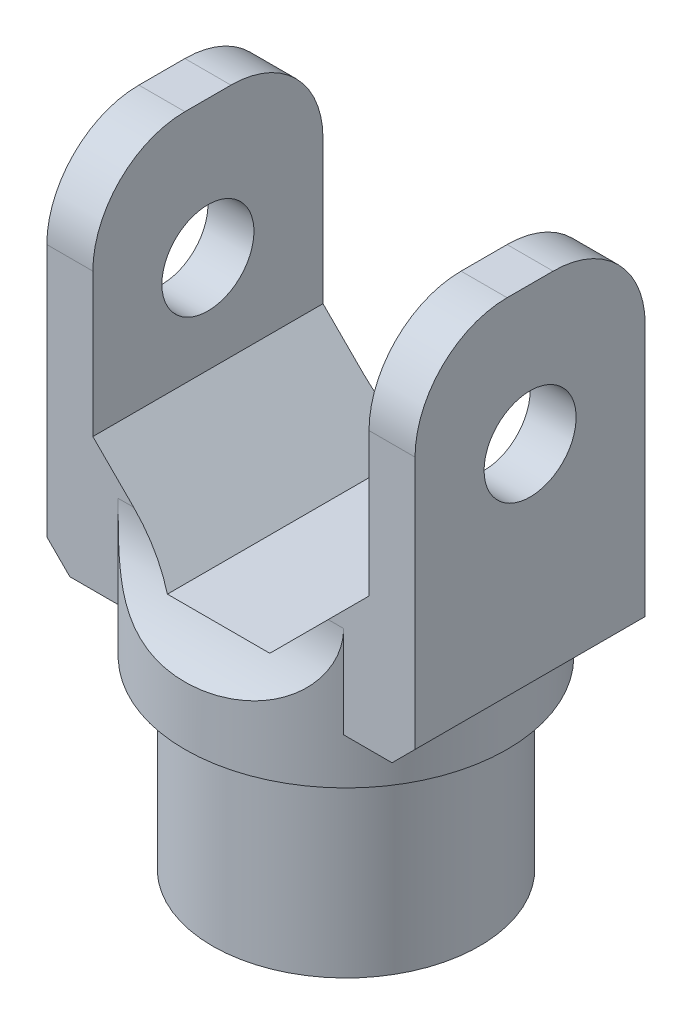
from build123d import *

# Parameters (mm, degrees)
SKETCH2_R           = 18.415
SKETCH2_R_2         = 15.875
BOSS_EXTRUDE1_DEPTH = 25.4
SKETCH3_R           = 22.225
BOSS_EXTRUDE2_DEPTH = 6.35
SKETCH5_W           = 50.8
SKETCH5_H           = 31.75
BOSS_EXTRUDE3_DEPTH = 50.8
CUT_EXTRUDE2_DEPTH  = 50.8
FILLET1_R           = 12.7
SKETCH9_R           = 6.35
CUT_EXTRUDE3_DEPTH  = 100.443919497
FILLET2_R           = 12.7


with BuildPart() as part:
    # Sketch2 → Boss-Extrude1 (new body)
    with BuildSketch(Plane(origin=(0, 0, 0), x_dir=(1, 0, 0), z_dir=(0, 1, 0))):
        with Locations(Location((0, 0, 0), (0, 0, 270))):
            Circle(SKETCH2_R)
        with Locations(Location((0, 0, 0), (0, 0, 270))):
            Circle(SKETCH2_R_2, mode=Mode.SUBTRACT)
    extrude(amount=BOSS_EXTRUDE1_DEPTH)

    # Sketch3 → Boss-Extrude2 (add)
    with BuildSketch(Plane(origin=(0, 25.4, 0), x_dir=(1, 0, 0), z_dir=(0, 1, 0))):
        with Locations(Location((0, 0, 0), (0, 0, 270))):
            Circle(SKETCH3_R)
    extrude(amount=BOSS_EXTRUDE2_DEPTH)

    # Sketch5 → Boss-Extrude3 (add)
    with BuildSketch(Plane(origin=(0, 31.75, 0), x_dir=(1, 0, 0), z_dir=(0, 1, 0))):
        Rectangle(SKETCH5_W, SKETCH5_H)
    extrude(amount=BOSS_EXTRUDE3_DEPTH)

    # Sketch7 → Cut-Extrude2 (cut)
    with BuildSketch(Plane.XY.offset(15.875)):
        Polygon((19.05, 82.55), (-19.05, 82.55), (-19.05, 50.084319149), (-7.065680851, 38.1), (7.065680851, 38.1), (19.05, 50.084319149), align=None)
        Polygon((-22.225, 31.75), (-25.4, 34.925), (-25.4, 31.75), align=None)
        Polygon((22.225, 31.75), (25.4, 34.925), (25.4, 31.75), align=None)
    extrude(amount=-CUT_EXTRUDE2_DEPTH, mode=Mode.SUBTRACT)

    # Fillet1
    fillet1_edges = [part.edges().sort_by_distance(p)[0] for p in [
        (22.225, 82.55, -15.875),
        (-22.225, 82.55, 15.875),
        (-22.225, 82.55, -15.875),
        (22.225, 82.55, 15.875),
    ]]
    fillet(fillet1_edges, radius=FILLET1_R)

    # Sketch9 → Cut-Extrude3 (cut, through all)
    with BuildSketch(Plane.ZY.offset(25.4)):
        with Locations((0, 63.5)):
            Circle(SKETCH9_R)
    extrude(amount=-CUT_EXTRUDE3_DEPTH, mode=Mode.SUBTRACT)

    # Fillet2
    # the kernel refuses this fillet: 12.7 mm, written as the material it adds along each edge
    with BuildSketch(Plane(origin=(-47.304259867, 31.75, 15.875), x_dir=(0, 1, 0), z_dir=(1, 0, 0))) as fillet2_piece_1_section:
        with BuildLine():
            CenterArc((FILLET2_R, FILLET2_R), FILLET2_R, 180, 90)
            Line((0, FILLET2_R), (0, 0))
            Line((0, 0), (FILLET2_R, 0))
        make_face()
    fillet2_piece_1 = extrude(amount=94.608519733, mode=Mode.PRIVATE)
    fillet2_piece_1 = split(fillet2_piece_1, bisect_by=Plane(origin=(-10.08116257, 41.115481719, 16.394719063), z_dir=(-0.7071067811865479, -0.7071067811865472, 0)), keep=Keep.TOP, mode=Mode.PRIVATE)
    fillet2_piece_1 = fillet2_piece_1 & Plane(origin=(0, 39.477824878, 0), x_dir=(0, 0, 1), z_dir=(0, -1, 0)) * Cylinder(22.225, 241, mode=Mode.PRIVATE)
    add(fillet2_piece_1)
    with BuildSketch(Plane(origin=(-47.304259867, 31.75, 15.875), x_dir=(0, 1, 0), z_dir=(1, 0, 0))) as fillet2_piece_2_section:
        with BuildLine():
            CenterArc((FILLET2_R, FILLET2_R), FILLET2_R, 180, 90)
            Line((0, FILLET2_R), (0, 0))
            Line((0, 0), (FILLET2_R, 0))
        make_face()
    fillet2_piece_2 = extrude(amount=94.608519733, mode=Mode.PRIVATE)
    fillet2_piece_2 = split(fillet2_piece_2, bisect_by=Plane(origin=(1e-09, 38.1, 17.97624181), z_dir=(0, -1, 0)), keep=Keep.TOP, mode=Mode.PRIVATE)
    fillet2_piece_2 = fillet2_piece_2 & Plane(origin=(0, 35.120576784, 0), x_dir=(0, 0, 1), z_dir=(0, -1, 0)) * Cylinder(22.225, 241, mode=Mode.PRIVATE)
    add(fillet2_piece_2)
    with BuildSketch(Plane(origin=(-47.304259867, 31.75, 15.875), x_dir=(0, 1, 0), z_dir=(1, 0, 0))) as fillet2_piece_3_section:
        with BuildLine():
            CenterArc((FILLET2_R, FILLET2_R), FILLET2_R, 180, 90)
            Line((0, FILLET2_R), (0, 0))
            Line((0, 0), (FILLET2_R, 0))
        make_face()
    fillet2_piece_3 = extrude(amount=94.608519733, mode=Mode.PRIVATE)
    fillet2_piece_3 = split(fillet2_piece_3, bisect_by=Plane(origin=(10.081162473, 41.115481622, 16.394719049), z_dir=(0.7071067811865472, -0.7071067811865478, 0)), keep=Keep.TOP, mode=Mode.PRIVATE)
    fillet2_piece_3 = fillet2_piece_3 & Plane(origin=(0, 39.477824822, 0), x_dir=(0, 0, 1), z_dir=(0, -1, 0)) * Cylinder(22.225, 241, mode=Mode.PRIVATE)
    add(fillet2_piece_3)
    with BuildSketch(Plane(origin=(47.304259867, 31.75, -15.875), x_dir=(0, 1, 0), z_dir=(-1, 0, 0))) as fillet2_piece_4_section:
        with BuildLine():
            CenterArc((FILLET2_R, FILLET2_R), FILLET2_R, 180, 90)
            Line((0, FILLET2_R), (0, 0))
            Line((0, 0), (FILLET2_R, 0))
        make_face()
    fillet2_piece_4 = extrude(amount=94.608519733, mode=Mode.PRIVATE)
    fillet2_piece_4 = split(fillet2_piece_4, bisect_by=Plane(origin=(10.08116257, 41.115481719, -16.394719063), z_dir=(0.7071067811865472, -0.7071067811865478, 0)), keep=Keep.TOP, mode=Mode.PRIVATE)
    fillet2_piece_4 = fillet2_piece_4 & Plane(origin=(0, 39.477824879, 0), x_dir=(0, 0, 1), z_dir=(0, -1, 0)) * Cylinder(22.225, 241, mode=Mode.PRIVATE)
    add(fillet2_piece_4)
    with BuildSketch(Plane(origin=(47.304259867, 31.75, -15.875), x_dir=(0, 1, 0), z_dir=(-1, 0, 0))) as fillet2_piece_5_section:
        with BuildLine():
            CenterArc((FILLET2_R, FILLET2_R), FILLET2_R, 180, 90)
            Line((0, FILLET2_R), (0, 0))
            Line((0, 0), (FILLET2_R, 0))
        make_face()
    fillet2_piece_5 = extrude(amount=94.608519733, mode=Mode.PRIVATE)
    fillet2_piece_5 = split(fillet2_piece_5, bisect_by=Plane(origin=(0, 38.1, -17.976241803), z_dir=(0, -1, 0)), keep=Keep.TOP, mode=Mode.PRIVATE)
    fillet2_piece_5 = fillet2_piece_5 & Plane(origin=(0, 35.120576783, 0), x_dir=(0, 0, 1), z_dir=(0, -1, 0)) * Cylinder(22.225, 241, mode=Mode.PRIVATE)
    add(fillet2_piece_5)
    with BuildSketch(Plane(origin=(47.304259867, 31.75, -15.875), x_dir=(0, 1, 0), z_dir=(-1, 0, 0))) as fillet2_piece_6_section:
        with BuildLine():
            CenterArc((FILLET2_R, FILLET2_R), FILLET2_R, 180, 90)
            Line((0, FILLET2_R), (0, 0))
            Line((0, 0), (FILLET2_R, 0))
        make_face()
    fillet2_piece_6 = extrude(amount=94.608519733, mode=Mode.PRIVATE)
    fillet2_piece_6 = split(fillet2_piece_6, bisect_by=Plane(origin=(-10.081162473, 41.115481622, -16.394719049), z_dir=(-0.7071067811865479, -0.7071067811865472, 0)), keep=Keep.TOP, mode=Mode.PRIVATE)
    fillet2_piece_6 = fillet2_piece_6 & Plane(origin=(0, 39.477824822, 0), x_dir=(0, 0, 1), z_dir=(0, -1, 0)) * Cylinder(22.225, 241, mode=Mode.PRIVATE)
    add(fillet2_piece_6)


solid = part.part
